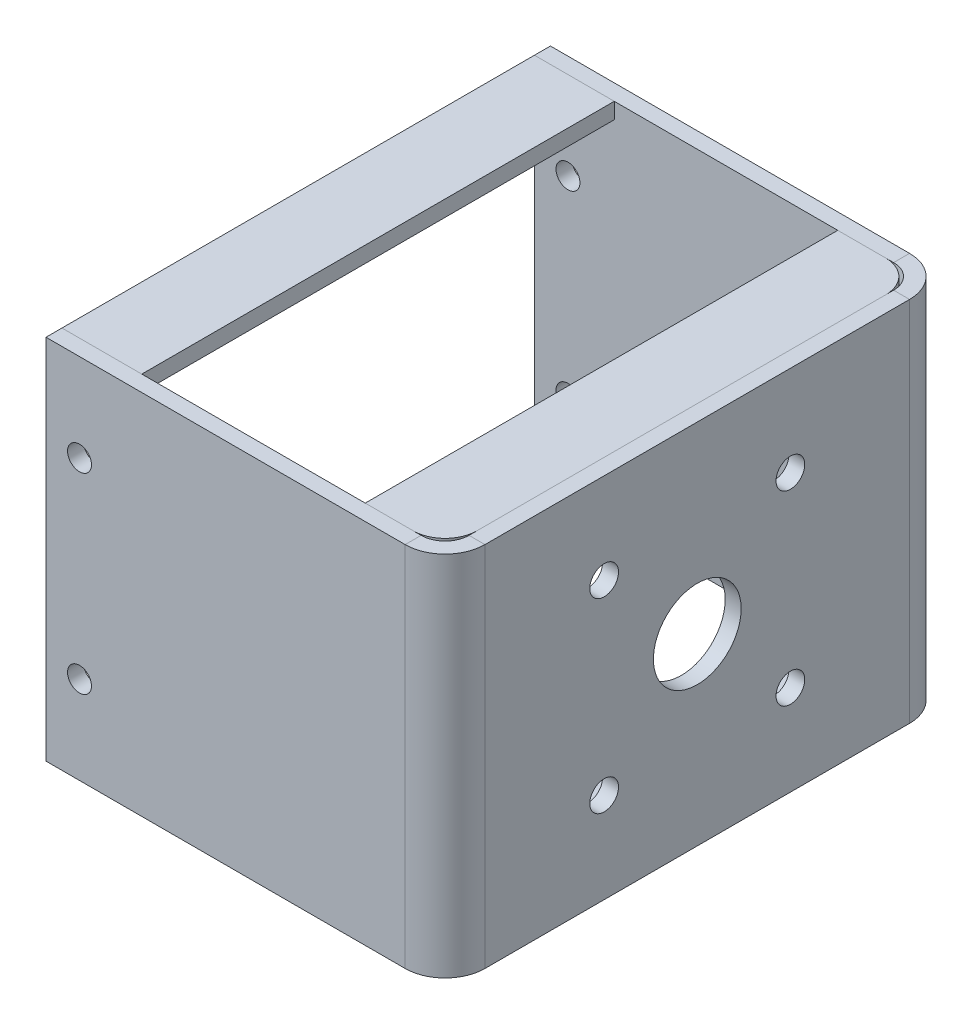
from build123d import *

# Parameters (mm, degrees)
SKETCH1_W                      = 316
SKETCH1_H                      = 230
BASE_FLANGE1_DEPTH             = 10
EDGE_FLANGE1_STRIP_W           = 70
EDGE_FLANGE1_STRIP_H           = 10
EDGE_FLANGE1_STRIP_CUT_DEPTH   = 230
EDGE_FLANGE1_STRIP_2_W         = 70
EDGE_FLANGE1_STRIP_2_H         = 10
EDGE_FLANGE1_STRIP_CUT_2_DEPTH = 230
EDGE_FLANGE1_DEPTH             = 230
EDGE_FLANGE1_BEND_DEPTH        = 230
SKETCH12_R                     = 27.5
CUT_EXTRUDE1_DEPTH             = 10
SKETCH13_R                     = 7.5
CUT_EXTRUDE2_DEPTH             = 420.023865669
SKETCH14_R                     = 9
CUT_EXTRUDE3_DEPTH             = 10
BOSS_EXTRUDE1_DEPTH            = 10
SKETCH15_W                     = 50
SKETCH15_H                     = 296
BOSS_EXTRUDE1_2_DEPTH          = 10
CIRPATTERN1_COUNT              = 4


# Sheet-metal steps are written as plain solids
with BuildPart() as part:
    # Sketch1 → Base-Flange1 (new body)
    with BuildSketch(Plane(origin=(0, 0, 0), x_dir=(0, 0, -1), z_dir=(1, 0, 0))):
        Rectangle(SKETCH1_W, SKETCH1_H)
    extrude(amount=-BASE_FLANGE1_DEPTH)

    # Edge-Flange1 strip (across the edge) → Edge-Flange1 strip cut (cut)
    with BuildSketch(Plane(origin=(-10, -115, 158), x_dir=(0, 0, -1), z_dir=(0, 1, 0))):
        with Locations((-10, -5)):
            Rectangle(EDGE_FLANGE1_STRIP_W, EDGE_FLANGE1_STRIP_H)
    extrude(amount=EDGE_FLANGE1_STRIP_CUT_DEPTH, mode=Mode.SUBTRACT)

    # Edge-Flange1 strip 2 (across the edge) → Edge-Flange1 strip cut 2 (cut)
    with BuildSketch(Plane(origin=(-10, 115, -158), x_dir=(0, 0, 1), z_dir=(0, -1, 0))):
        with Locations((-10, -5)):
            Rectangle(EDGE_FLANGE1_STRIP_2_W, EDGE_FLANGE1_STRIP_2_H)
    extrude(amount=EDGE_FLANGE1_STRIP_CUT_2_DEPTH, mode=Mode.SUBTRACT)

    # Edge-Flange1 section (across the edge) → Edge-Flange1 (add)
    with BuildSketch(Plane(origin=(-10, -115, 158), x_dir=(0, 0, -1), z_dir=(0, 1, 0))):
        with BuildLine():
            Line((0, 15), (0, 240))
            Line((0, 240), (10, 240))
            Line((10, 240), (10, 15))
            ThreePointArc((10, 15), (14.393398282, 4.393398282), (25, 0))
            Line((25, 0), (25, -10))
            ThreePointArc((25, -10), (7.32233047, -2.67766953), (0, 15))
        make_face()
    extrude(amount=EDGE_FLANGE1_DEPTH)

    # Edge-Flange1 section 2 (across the edge) → Edge-Flange1 bend (add)
    with BuildSketch(Plane(origin=(-10, 115, -158), x_dir=(0, 0, 1), z_dir=(0, -1, 0))):
        with BuildLine():
            Line((0, 15), (0, 240))
            Line((0, 240), (10, 240))
            Line((10, 240), (10, 15))
            ThreePointArc((10, 15), (14.393398282, 4.393398282), (25, 0))
            Line((25, 0), (25, -10))
            ThreePointArc((25, -10), (7.32233047, -2.67766953), (0, 15))
        make_face()
    extrude(amount=EDGE_FLANGE1_BEND_DEPTH)

    # Sketch12 → Cut-Extrude1 (cut)
    with BuildSketch(Plane(origin=(0, 0, 0), x_dir=(0, 0, -1), z_dir=(1, 0, 0))):
        Circle(SKETCH12_R)
    extrude(amount=-CUT_EXTRUDE1_DEPTH, mode=Mode.SUBTRACT)

    # Sketch13 → Cut-Extrude2 (cut, through all)
    with BuildSketch(Plane.XY.offset(158)):
        with Locations((-229, 60)):
            Circle(SKETCH13_R)
    cut_extrude2 = extrude(amount=-CUT_EXTRUDE2_DEPTH, mode=Mode.SUBTRACT)

    # Sketch14 → Cut-Extrude3 (cut)
    with BuildSketch(Plane(origin=(0, 0, 0), x_dir=(0, 0, -1), z_dir=(1, 0, 0))):
        with Locations((-58.336309448, 58.336309448)):
            Circle(SKETCH14_R)
    cut_extrude3 = extrude(amount=-CUT_EXTRUDE3_DEPTH, mode=Mode.SUBTRACT)

    # Mirror1: Cut-Extrude2 across plane
    add(cut_extrude2.mirror(Plane.ZX), mode=Mode.SUBTRACT)

    # CirPattern1: Cut-Extrude3 ×4 about axis
    cirpattern1_axis = Axis((0, 0, 0), (1, 0, 0))
    for i in range(1, CIRPATTERN1_COUNT):
        add(cut_extrude3.rotate(cirpattern1_axis, i * 360 / CIRPATTERN1_COUNT), mode=Mode.SUBTRACT)


with BuildPart() as body_2:
    # Sketch15 → Boss-Extrude1 (new body)
    with BuildSketch(Plane(origin=(0, 115, 0), x_dir=(1, 0, 0), z_dir=(0, 1, 0))):
        with BuildLine():
            Line((-60, 148), (-30, 148))
            ThreePointArc((-30, 148), (-15.857864376, 142.142135624), (-10, 128))
            Line((-10, 128), (-10, -128))
            ThreePointArc((-10, -128), (-15.857864376, -142.142135624), (-30, -148))
            Line((-30, -148), (-60, -148))
            Line((-60, -148), (-60, 148))
        make_face()
    extrude(amount=-BOSS_EXTRUDE1_DEPTH)


with BuildPart() as body_3:
    # Sketch15 → Boss-Extrude1 2 (new body)
    with BuildSketch(Plane(origin=(0, 115, 0), x_dir=(1, 0, 0), z_dir=(0, 1, 0))):
        with Locations((-225, 0)):
            Rectangle(SKETCH15_W, SKETCH15_H)
    extrude(amount=-BOSS_EXTRUDE1_2_DEPTH)


with BuildPart() as body_4:
    # Mirror2: mirrored copy
    add(body_2.part.mirror(Plane.ZX))


with BuildPart() as body_5:
    # Mirror2 2: mirrored copy
    add(body_3.part.mirror(Plane.ZX))


solid = Compound([part.part, body_2.part, body_3.part, body_4.part, body_5.part])
